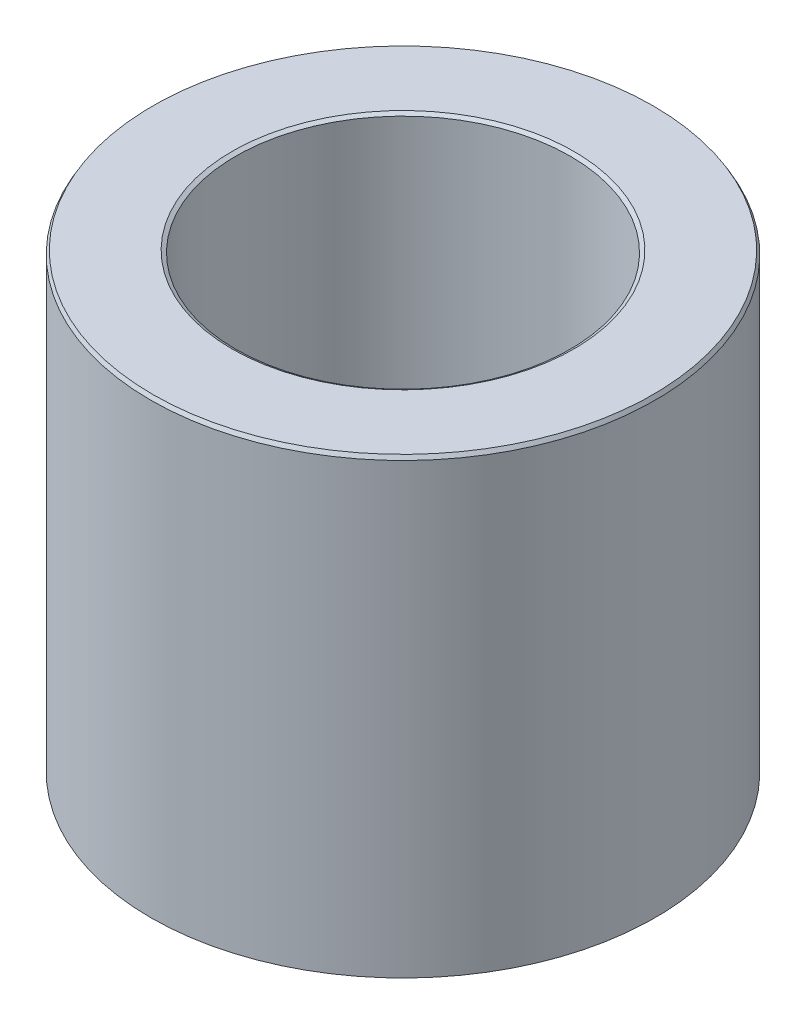
from build123d import *
from OCP.BRepFilletAPI import BRepFilletAPI_MakeChamfer

# Parameters (mm, degrees)
SKETCH1_R           = 45
BOSS_EXTRUDE1_DEPTH = 81.005665782
SKETCH2_R           = 29.836563793
CUT_EXTRUDE1_DEPTH  = 104.014163535
CHAMFER1_SIZE       = 0.674284707
CHAMFER1_SIZE2      = 0.389298457


with BuildPart() as part:
    # Sketch1 → Boss-Extrude1 (new body)
    with BuildSketch(Plane(origin=(0, 0, 0), x_dir=(1, 0, 0), z_dir=(0, 1, 0))):
        Circle(SKETCH1_R)
    extrude(amount=BOSS_EXTRUDE1_DEPTH)

    # Sketch2 → Cut-Extrude1 (cut, through all)
    with BuildSketch(Plane(origin=(0, 0, 0), x_dir=(1, 0, 0), z_dir=(0, 1, 0))):
        Circle(SKETCH2_R)
    extrude(amount=CUT_EXTRUDE1_DEPTH, mode=Mode.SUBTRACT)

    # Chamfer1: one chamfer whose edges measure the first distance from different faces: ONE call of the kernel's chamfer builder (chamfer() names one face for all edges)
    chamfer1_edges_1 = [part.edges().sort_by_distance(p)[0] for p in [
        (-29.836563793, 81.005665782, 0),
    ]]
    chamfer1_side_1 = [part.faces().sort_by_distance(p)[0] for p in [
        (-43.727207794, 81.005665782, 0),
    ]]
    chamfer1_edges_2 = [part.edges().sort_by_distance(p)[0] for p in [
        (-29.836563793, 0, 0),
    ]]
    chamfer1_side_2 = [part.faces().sort_by_distance(p)[0] for p in [
        (-29.836563793, 40.502832891, 0),
    ]]
    chamfer1_edges_3 = [part.edges().sort_by_distance(p)[0] for p in [
        (-45, 0, 0),
    ]]
    chamfer1_side_3 = [part.faces().sort_by_distance(p)[0] for p in [
        (-43.727207794, 0, 0),
    ]]
    chamfer1_edges_4 = [part.edges().sort_by_distance(p)[0] for p in [
        (-45, 81.005665782, 0),
    ]]
    chamfer1_side_4 = [part.faces().sort_by_distance(p)[0] for p in [
        (-45, 40.502832891, 0),
    ]]
    chamfer1 = BRepFilletAPI_MakeChamfer(part.part.solid().wrapped)
    for e in chamfer1_edges_1:
        chamfer1.Add(CHAMFER1_SIZE, CHAMFER1_SIZE2, e.wrapped, chamfer1_side_1[0].wrapped)  # the first distance lies on this face
    for e in chamfer1_edges_2:
        chamfer1.Add(CHAMFER1_SIZE, CHAMFER1_SIZE2, e.wrapped, chamfer1_side_2[0].wrapped)  # the first distance lies on this face
    for e in chamfer1_edges_3:
        chamfer1.Add(CHAMFER1_SIZE, CHAMFER1_SIZE2, e.wrapped, chamfer1_side_3[0].wrapped)  # the first distance lies on this face
    for e in chamfer1_edges_4:
        chamfer1.Add(CHAMFER1_SIZE, CHAMFER1_SIZE2, e.wrapped, chamfer1_side_4[0].wrapped)  # the first distance lies on this face
    add(Compound.cast(chamfer1.Shape()), mode=Mode.REPLACE)


solid = part.part
